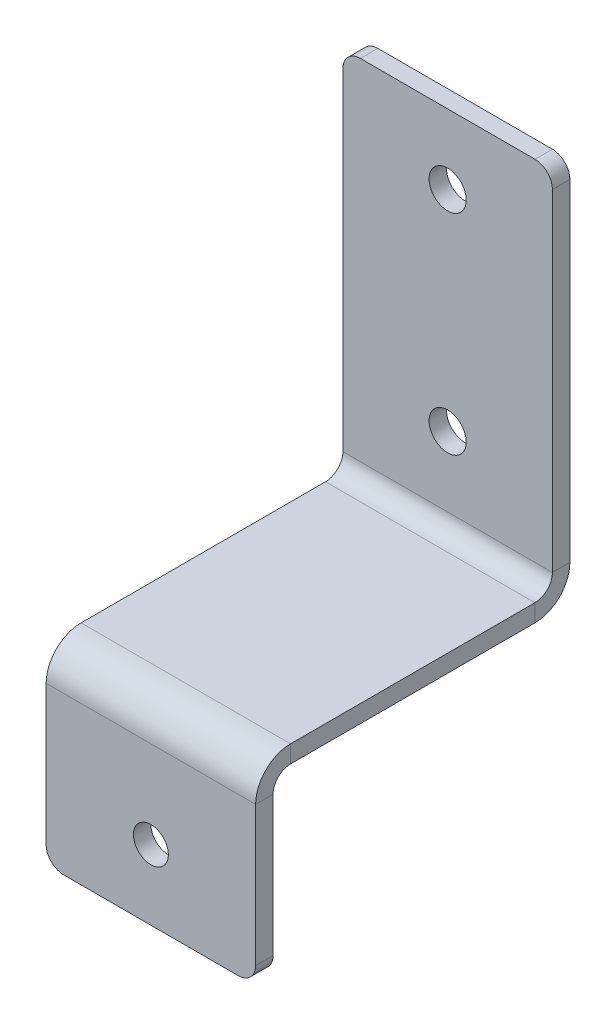
from build123d import *

# Parameters (mm, degrees)
SKETCH1_W                    = 38.1
SKETCH1_H                    = 57.15
BASE_FLANGE1_DEPTH           = 3.175
EDGE_FLANGE1_STRIP_W         = 19.05
EDGE_FLANGE1_STRIP_H         = 3.175
EDGE_FLANGE1_STRIP_CUT_DEPTH = 38.1
EDGE_FLANGE1_DEPTH           = 38.1
EDGE_FLANGE2_STRIP_W         = 19.05
EDGE_FLANGE2_STRIP_H         = 3.175
EDGE_FLANGE2_STRIP_CUT_DEPTH = 38.1
EDGE_FLANGE2_DEPTH           = 38.1
F_1_4_CLEARANCE_HOLE1_D      = 6.7564
F_1_4_20_TAPPED_HOLE1_D      = 6.35
BREAK_CORNER1_START          = -57.15
BREAK_CORNER1_DEPTH          = 57.15


# Read off the part's stored shape, not the designer's step: Break-Corner1
# Sheet-metal steps are written as plain solids
with BuildPart() as part:
    # Sketch1 → Base-Flange1 (new body)
    with BuildSketch(Plane(origin=(0, 0, 0), x_dir=(1, 0, 0), z_dir=(0, 1, 0))):
        with Locations((19.05, 28.575)):
            Rectangle(SKETCH1_W, SKETCH1_H)
    extrude(amount=-BASE_FLANGE1_DEPTH)

    # Edge-Flange1 strip (across the edge) → Edge-Flange1 strip cut (cut)
    with BuildSketch(Plane(origin=(38.1, 0, -57.15), x_dir=(0, 0, 1), z_dir=(-1, 0, 0))):
        with Locations((-3.175, -1.5875)):
            Rectangle(EDGE_FLANGE1_STRIP_W, EDGE_FLANGE1_STRIP_H)
    extrude(amount=EDGE_FLANGE1_STRIP_CUT_DEPTH, mode=Mode.SUBTRACT)

    # Edge-Flange1 section (across the edge) → Edge-Flange1 (add)
    with BuildSketch(Plane(origin=(38.1, 0, -57.15), x_dir=(0, 0, 1), z_dir=(-1, 0, 0))):
        with BuildLine():
            Line((0, 3.175), (0, 66.675))
            Line((0, 66.675), (3.175, 66.675))
            Line((3.175, 66.675), (3.175, 3.175))
            ThreePointArc((3.175, 3.175), (4.10493597, 0.92993597), (6.35, 0))
            Line((6.35, 0), (6.35, -3.175))
            ThreePointArc((6.35, -3.175), (1.859871939, -1.315128061), (0, 3.175))
        make_face()
    extrude(amount=EDGE_FLANGE1_DEPTH)

    # Edge-Flange2 strip (across the edge) → Edge-Flange2 strip cut (cut)
    with BuildSketch(Plane(origin=(38.1, -3.175, 0), x_dir=(0, 0, -1), z_dir=(-1, 0, 0))):
        with Locations((-3.175, -1.5875)):
            Rectangle(EDGE_FLANGE2_STRIP_W, EDGE_FLANGE2_STRIP_H)
    extrude(amount=EDGE_FLANGE2_STRIP_CUT_DEPTH, mode=Mode.SUBTRACT)

    # Edge-Flange2 section (across the edge) → Edge-Flange2 (add)
    with BuildSketch(Plane(origin=(38.1, -3.175, 0), x_dir=(0, 0, -1), z_dir=(-1, 0, 0))):
        with BuildLine():
            Line((0, 3.175), (0, 31.75))
            Line((0, 31.75), (3.175, 31.75))
            Line((3.175, 31.75), (3.175, 3.175))
            ThreePointArc((3.175, 3.175), (4.10493597, 0.92993597), (6.35, 0))
            Line((6.35, 0), (6.35, -3.175))
            ThreePointArc((6.35, -3.175), (1.859871939, -1.315128061), (0, 3.175))
        make_face()
    extrude(amount=EDGE_FLANGE2_DEPTH)

    # 1/4 Clearance Hole1 (through all)
    with Locations(Plane.XY.offset(-53.975)):
        with Locations((19.05, 53.975), (19.05, 15.875)):
            Hole(F_1_4_CLEARANCE_HOLE1_D / 2)

    # 1/4-20 Tapped Hole1 (through all)
    with Locations(Plane.XY):
        with Locations((19.05, -22.225)):
            Hole(F_1_4_20_TAPPED_HOLE1_D / 2)

    # Break-Corner1 outline → Break-Corner1 (cut)
    with BuildSketch(Plane.XY.offset(BREAK_CORNER1_START)):
        with BuildLine():
            Line((38.1, -34.925), (38.1, -31.75))
            ThreePointArc((38.1, -31.75), (37.17006403, -33.99506403), (34.925, -34.925))
            Line((34.925, -34.925), (38.1, -34.925))
        make_face()
        with BuildLine():
            Line((0, -34.925), (3.175, -34.925))
            ThreePointArc((3.175, -34.925), (0.92993597, -33.99506403), (0, -31.75))
            Line((0, -31.75), (0, -34.925))
        make_face()
        with BuildLine():
            ThreePointArc((0, 63.5), (0.92993597, 65.74506403), (3.175, 66.675))
            Line((3.175, 66.675), (0, 66.675))
            Line((0, 66.675), (0, 63.5))
        make_face()
        with BuildLine():
            ThreePointArc((34.925, 66.675), (37.17006403, 65.74506403), (38.1, 63.5))
            Line((38.1, 63.5), (38.1, 66.675))
            Line((38.1, 66.675), (34.925, 66.675))
        make_face()
    extrude(amount=BREAK_CORNER1_DEPTH, mode=Mode.SUBTRACT)


solid = part.part
